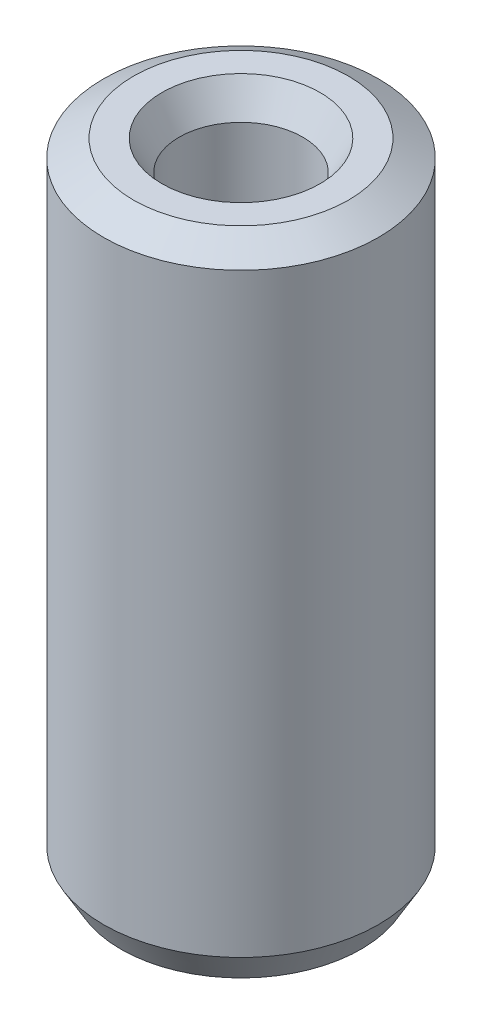
from build123d import *
from OCP.BRepFilletAPI import BRepFilletAPI_MakeChamfer

# Parameters (mm, degrees)
SKETCH1_R           = 7.5
BOSS_EXTRUDE1_DEPTH = 35.05719489
SKETCH2_R           = 3.371312752
CUT_EXTRUDE1_DEPTH  = 37.626587523
CHAMFER1_SIZE       = 0.944433469
CHAMFER1_SIZE2      = 1.635806752


with BuildPart() as part:
    # Sketch1 → Boss-Extrude1 (new body)
    with BuildSketch(Plane(origin=(0, 0, 0), x_dir=(1, 0, 0), z_dir=(0, 1, 0))):
        Circle(SKETCH1_R)
    extrude(amount=BOSS_EXTRUDE1_DEPTH)

    # Sketch2 → Cut-Extrude1 (cut, through all)
    with BuildSketch(Plane(origin=(0, 0, 0), x_dir=(1, 0, 0), z_dir=(0, 1, 0))):
        Circle(SKETCH2_R)
    extrude(amount=CUT_EXTRUDE1_DEPTH, mode=Mode.SUBTRACT)

    # Chamfer1: one chamfer whose edges measure the first distance from different faces: ONE call of the kernel's chamfer builder (chamfer() names one face for all edges)
    chamfer1_edges_1 = [part.edges().sort_by_distance(p)[0] for p in [
        (-3.371312752, 35.05719489, 0),
    ]]
    chamfer1_side_1 = [part.faces().sort_by_distance(p)[0] for p in [
        (-7.287867966, 35.05719489, 0),
    ]]
    chamfer1_edges_2 = [part.edges().sort_by_distance(p)[0] for p in [
        (-3.371312752, 0, 0),
    ]]
    chamfer1_side_2 = [part.faces().sort_by_distance(p)[0] for p in [
        (-3.371312752, 17.528597445, 0),
    ]]
    chamfer1_edges_3 = [part.edges().sort_by_distance(p)[0] for p in [
        (-7.5, 0, 0),
    ]]
    chamfer1_side_3 = [part.faces().sort_by_distance(p)[0] for p in [
        (-7.287867966, 0, 0),
    ]]
    chamfer1_edges_4 = [part.edges().sort_by_distance(p)[0] for p in [
        (-7.5, 35.05719489, 0),
    ]]
    chamfer1_side_4 = [part.faces().sort_by_distance(p)[0] for p in [
        (-7.5, 17.528597445, 0),
    ]]
    chamfer1 = BRepFilletAPI_MakeChamfer(part.part.solid().wrapped)
    for e in chamfer1_edges_1:
        chamfer1.Add(CHAMFER1_SIZE, CHAMFER1_SIZE2, e.wrapped, chamfer1_side_1[0].wrapped)  # the first distance lies on this face
    for e in chamfer1_edges_2:
        chamfer1.Add(CHAMFER1_SIZE, CHAMFER1_SIZE2, e.wrapped, chamfer1_side_2[0].wrapped)  # the first distance lies on this face
    for e in chamfer1_edges_3:
        chamfer1.Add(CHAMFER1_SIZE, CHAMFER1_SIZE2, e.wrapped, chamfer1_side_3[0].wrapped)  # the first distance lies on this face
    for e in chamfer1_edges_4:
        chamfer1.Add(CHAMFER1_SIZE, CHAMFER1_SIZE2, e.wrapped, chamfer1_side_4[0].wrapped)  # the first distance lies on this face
    add(Compound.cast(chamfer1.Shape()), mode=Mode.REPLACE)


solid = part.part
